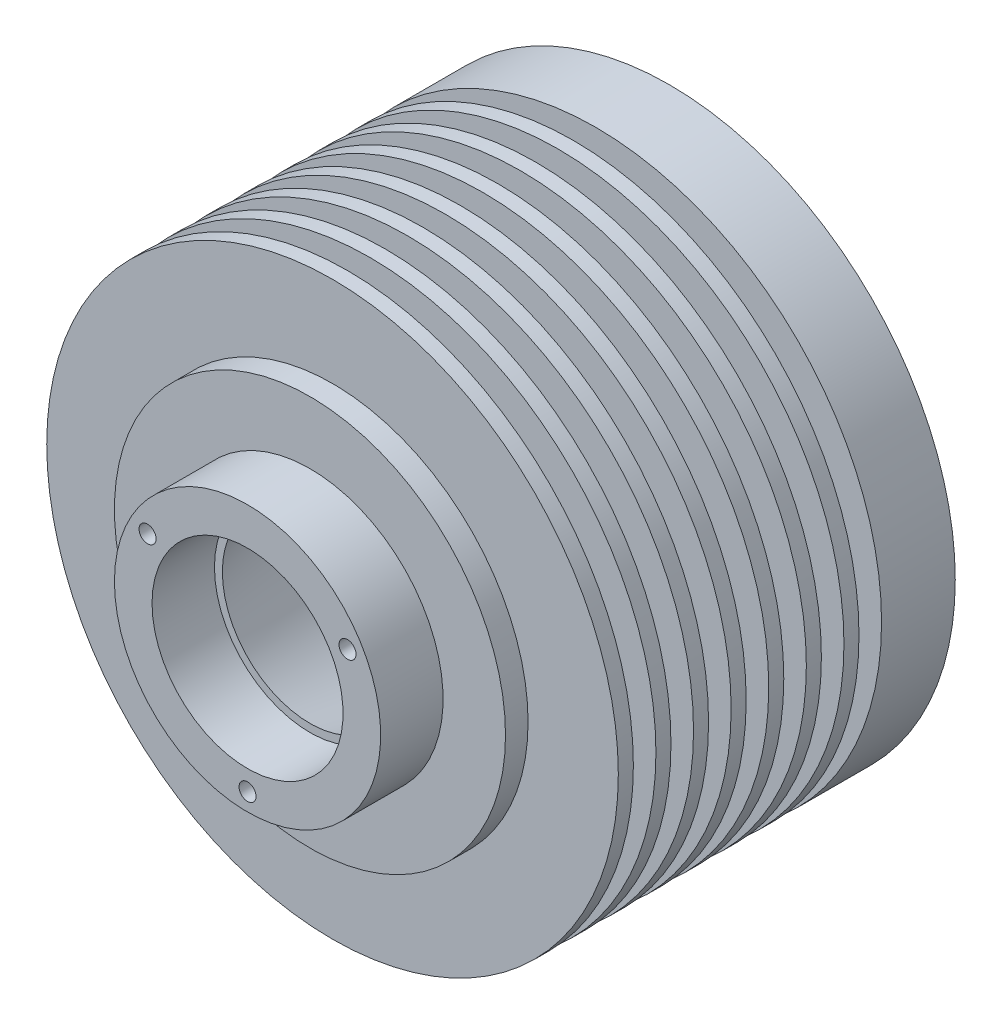
from build123d import *

# Parameters (mm, degrees)
ESQUISSE1_R        = 17.7
ESQUISSE1_R_2      = 12.7
BOSS_EXTRU_1_DEPTH = 8.3
ESQUISSE2_R        = 38
ESQUISSE2_R_2      = 11.2
BOSS_EXTRU_2_DEPTH = 47.8
CHANFREIN3_SIZE    = 11.200084029
CHANFREIN3_SIZE_2  = 49.8
SKETCH7_R          = 38
SKETCH7_R_2        = 26
CUT_EXTRUDE2_DEPTH = 3
CIRPATTERN1_COUNT  = 4
CIRPATTERN2_COUNT  = 3
LPATTERN1_COUNT    = 8
LPATTERN1_PITCH    = 5


with BuildPart() as part:
    # Esquisse1 → Boss.-Extru.1 (new body)
    with BuildSketch(Plane.XY):
        with Locations(Location((0, 0, 0), (0, 0, 180))):
            Circle(ESQUISSE1_R)
        with Locations(Location((0, 0, 0), (0, 0, 180))):
            Circle(ESQUISSE1_R_2, mode=Mode.SUBTRACT)
    extrude(amount=BOSS_EXTRU_1_DEPTH)

    # Esquisse2 → Boss.-Extru.2 (add)
    with BuildSketch(Plane(origin=(0, 0, 0), x_dir=(-1, 0, 0), z_dir=(0, 0, -1))):
        with Locations(Location((0, 0, 0), (0, 0, 180))):
            Circle(ESQUISSE2_R)
        with Locations(Location((0, 0, 0), (0, 0, 180))):
            Circle(ESQUISSE2_R_2, mode=Mode.SUBTRACT)
    extrude(amount=BOSS_EXTRU_2_DEPTH)

    # Chanfrein3
    # the kernel refuses this chamfer: 49.8, 11.200084029 mm, written as the material it takes off along each edge
    with BuildSketch(Plane(origin=(0, 0, -47.8), x_dir=(1, 0, 0), z_dir=(0, 1, 0))) as chanfrein3_piece_1:
        Polygon((11.2 + CHANFREIN3_SIZE, 0), (11.2, -CHANFREIN3_SIZE_2), (11.2, 0), align=None)
    revolve(axis=Axis((0, 0, -47.8), (0, 0, -1)), mode=Mode.SUBTRACT)

    # Sketch7 → Cut-Extrude2 (cut)
    with BuildSketch(Plane.XY):
        Circle(SKETCH7_R)
        Circle(SKETCH7_R_2, mode=Mode.SUBTRACT)
    cut_extrude2 = extrude(amount=-CUT_EXTRUDE2_DEPTH, mode=Mode.SUBTRACT)

    # Sketch19 → #4-40 Tapped Hole1 (revolve, cut)
    with BuildSketch(Plane(origin=(0, -30, -47.8), x_dir=(0, 1, 0), z_dir=(1, 0, 0))):
        Polygon((0, 0), (0, 5.679152758), (1.1303, 5), (1.1303, 0), align=None)
    f_4_40_tapped_hole1 = revolve(axis=Axis((0, -30, -54.15), (0, 0, 1)), mode=Mode.SUBTRACT)

    # CirPattern1: #4-40 Tapped Hole1 ×4 about axis
    cirpattern1_axis = Axis((0, 0, 0), (0, 0, 1))
    for i in range(1, CIRPATTERN1_COUNT):
        add(f_4_40_tapped_hole1.rotate(cirpattern1_axis, i * 360 / CIRPATTERN1_COUNT), mode=Mode.SUBTRACT)

    # Sketch22 → #4-40 Tapped Hole2 (revolve, cut)
    with BuildSketch(Plane(origin=(0, -15.35, 8.3), x_dir=(0, -1, 0), z_dir=(1, 0, 0))):
        Polygon((0, 0), (0, 5.679152758), (1.1303, 5), (1.1303, 0), align=None)
    f_4_40_tapped_hole2 = revolve(axis=Axis((0, -15.35, 14.65), (0, 0, -1)), mode=Mode.SUBTRACT)

    # CirPattern2: #4-40 Tapped Hole2 ×3 about axis
    cirpattern2_axis = Axis((0, 0, 0), (0, 0, 1))
    for i in range(1, CIRPATTERN2_COUNT):
        add(f_4_40_tapped_hole2.rotate(cirpattern2_axis, i * 360 / CIRPATTERN2_COUNT), mode=Mode.SUBTRACT)

    # LPattern1: Cut-Extrude2 ×8
    with Locations(*[(0, 0, -i * LPATTERN1_PITCH) for i in range(1, LPATTERN1_COUNT)]):
        add(cut_extrude2, mode=Mode.SUBTRACT)


solid = part.part
